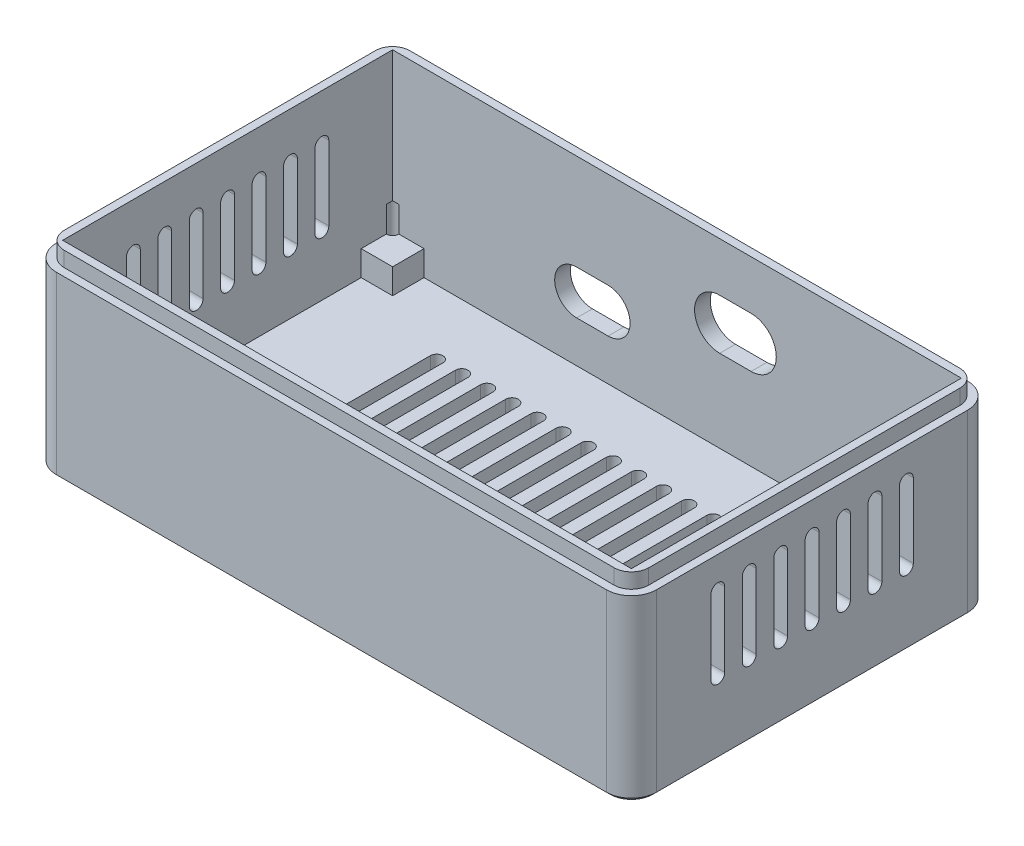
from build123d import *

# Parameters (mm, degrees)
CUERPO_DEPTH                  = 28.5
CROQUIS_HUECO_PCB_W           = 90.5
CROQUIS_HUECO_PCB_H           = 52.5
HUECO_PCB_DEPTH               = 26.5
CROQUIS_LABIO_W               = 90.5
CROQUIS_LABIO_H               = 52.5
LABIO_LIP_DEPTH               = 2.4
CROQUIS_APOYOS_W              = 5
CROQUIS_APOYOS_H              = 5
APOYOS_PCB_DEPTH              = 4
CROQUIS_ALIVIOS_R             = 1
ALIVIOS_ESQUINAS_DEPTH        = 8.1
SALIDAS_USB_Y_PANEL_DEPTH     = 64.729388825
VENTILAS_LATERALES_DEPTH      = 64.729388825
VENTILAS_LATERALES_DEPTH_BACK = 64.729388825
REJILLA_PISO_DEPTH            = 2
CHAFLAN_BASE_SIZE             = 0.6


with BuildPart() as part:
    # Croquis_contorno → Cuerpo (new body)
    with BuildSketch(Plane(origin=(0, 0, 0), x_dir=(1, 0, 0), z_dir=(0, 1, 0))):
        with BuildLine():
            Line((-43.75, -28.75), (43.75, -28.75))
            ThreePointArc((43.75, -28.75), (46.578427125, -27.578427125), (47.75, -24.75))
            Line((47.75, -24.75), (47.75, 24.75))
            ThreePointArc((47.75, 24.75), (46.578427125, 27.578427125), (43.75, 28.75))
            Line((43.75, 28.75), (-43.75, 28.75))
            ThreePointArc((-43.75, 28.75), (-46.578427125, 27.578427125), (-47.75, 24.75))
            Line((-47.75, 24.75), (-47.75, -24.75))
            ThreePointArc((-47.75, -24.75), (-46.578427125, -27.578427125), (-43.75, -28.75))
        make_face()
    extrude(amount=CUERPO_DEPTH)

    # Croquis_hueco_PCB → Hueco_PCB (cut)
    with BuildSketch(Plane(origin=(0, 28.5, 0), x_dir=(1, 0, 0), z_dir=(0, 1, 0))):
        Rectangle(CROQUIS_HUECO_PCB_W, CROQUIS_HUECO_PCB_H)
    extrude(amount=-HUECO_PCB_DEPTH, mode=Mode.SUBTRACT)

    # Croquis_labio → Labio_lip (add)
    with BuildSketch(Plane(origin=(0, 28.5, 0), x_dir=(1, 0, 0), z_dir=(0, 1, 0))):
        with BuildLine():
            Line((-43.75, -27.5), (43.75, -27.5))
            ThreePointArc((43.75, -27.5), (45.694543648, -26.694543648), (46.5, -24.75))
            Line((46.5, -24.75), (46.5, 24.75))
            ThreePointArc((46.5, 24.75), (45.694543648, 26.694543648), (43.75, 27.5))
            Line((43.75, 27.5), (-43.75, 27.5))
            ThreePointArc((-43.75, 27.5), (-45.694543648, 26.694543648), (-46.5, 24.75))
            Line((-46.5, 24.75), (-46.5, -24.75))
            ThreePointArc((-46.5, -24.75), (-45.694543648, -26.694543648), (-43.75, -27.5))
        make_face()
        Rectangle(CROQUIS_LABIO_W, CROQUIS_LABIO_H, mode=Mode.SUBTRACT)
    extrude(amount=LABIO_LIP_DEPTH)

    # Croquis_apoyos → Apoyos_PCB (add)
    with BuildSketch(Plane(origin=(0, 2, 0), x_dir=(1, 0, 0), z_dir=(0, 1, 0))):
        with Locations((-42.75, -23.75)):
            Rectangle(CROQUIS_APOYOS_W, CROQUIS_APOYOS_H)
        with Locations((-42.75, 23.75)):
            Rectangle(CROQUIS_APOYOS_W, CROQUIS_APOYOS_H)
        with Locations((42.75, -23.75)):
            Rectangle(CROQUIS_APOYOS_W, CROQUIS_APOYOS_H)
        with Locations((42.75, 23.75)):
            Rectangle(CROQUIS_APOYOS_W, CROQUIS_APOYOS_H)
    extrude(amount=APOYOS_PCB_DEPTH)

    # Croquis_alivios → Alivios_esquinas (cut)
    with BuildSketch(Plane(origin=(0, 2, 0), x_dir=(1, 0, 0), z_dir=(0, 1, 0))):
        with Locations((-45.25, -26.25)):
            Circle(CROQUIS_ALIVIOS_R)
        with Locations((-45.25, 26.25)):
            Circle(CROQUIS_ALIVIOS_R)
        with Locations((45.25, -26.25)):
            Circle(CROQUIS_ALIVIOS_R)
        with Locations((45.25, 26.25)):
            Circle(CROQUIS_ALIVIOS_R)
    extrude(amount=ALIVIOS_ESQUINAS_DEPTH, mode=Mode.SUBTRACT)

    # Croquis_salidas → Salidas_USB_y_panel (cut, through all)
    with BuildSketch(Plane.XY):
        with BuildLine():
            Line((6.8, 23.1), (11.8, 23.1))
            ThreePointArc((11.8, 23.1), (15.8, 19.1), (11.8, 15.1))
            Line((11.8, 15.1), (6.8, 15.1))
            ThreePointArc((6.8, 15.1), (2.8, 19.1), (6.8, 23.1))
        make_face()
        with BuildLine():
            Line((-15.96, 15.6), (-10.96, 15.6))
            ThreePointArc((-10.96, 15.6), (-7.46, 12.1), (-10.96, 8.6))
            Line((-10.96, 8.6), (-15.96, 8.6))
            ThreePointArc((-15.96, 8.6), (-19.46, 12.1), (-15.96, 15.6))
        make_face()
    extrude(amount=-SALIDAS_USB_Y_PANEL_DEPTH, mode=Mode.SUBTRACT)

    # Croquis_ventilas → Ventilas_laterales (cut, two sides: drawn at the far end of the back side and taken through both)
    with BuildSketch(Plane(origin=(0, 0, 0), x_dir=(0, 0, -1), z_dir=(1, 0, 0)).offset(-VENTILAS_LATERALES_DEPTH_BACK)):
        with BuildLine():
            Line((-16.1, 11.7), (-16.1, 23.5))
            ThreePointArc((-16.1, 23.5), (-15, 24.6), (-13.9, 23.5))
            Line((-13.9, 23.5), (-13.9, 11.7))
            ThreePointArc((-13.9, 11.7), (-15, 10.6), (-16.1, 11.7))
        make_face()
        with BuildLine():
            Line((-11.1, 11.7), (-11.1, 23.5))
            ThreePointArc((-11.1, 23.5), (-10, 24.6), (-8.9, 23.5))
            Line((-8.9, 23.5), (-8.9, 11.7))
            ThreePointArc((-8.9, 11.7), (-10, 10.6), (-11.1, 11.7))
        make_face()
        with BuildLine():
            Line((-6.1, 11.7), (-6.1, 23.5))
            ThreePointArc((-6.1, 23.5), (-5, 24.6), (-3.9, 23.5))
            Line((-3.9, 23.5), (-3.9, 11.7))
            ThreePointArc((-3.9, 11.7), (-5, 10.6), (-6.1, 11.7))
        make_face()
        with BuildLine():
            Line((-1.1, 11.7), (-1.1, 23.5))
            ThreePointArc((-1.1, 23.5), (0, 24.6), (1.1, 23.5))
            Line((1.1, 23.5), (1.1, 11.7))
            ThreePointArc((1.1, 11.7), (0, 10.6), (-1.1, 11.7))
        make_face()
        with BuildLine():
            Line((3.9, 11.7), (3.9, 23.5))
            ThreePointArc((3.9, 23.5), (5, 24.6), (6.1, 23.5))
            Line((6.1, 23.5), (6.1, 11.7))
            ThreePointArc((6.1, 11.7), (5, 10.6), (3.9, 11.7))
        make_face()
        with BuildLine():
            Line((8.9, 11.7), (8.9, 23.5))
            ThreePointArc((8.9, 23.5), (10, 24.6), (11.1, 23.5))
            Line((11.1, 23.5), (11.1, 11.7))
            ThreePointArc((11.1, 11.7), (10, 10.6), (8.9, 11.7))
        make_face()
        with BuildLine():
            Line((13.9, 11.7), (13.9, 23.5))
            ThreePointArc((13.9, 23.5), (15, 24.6), (16.1, 23.5))
            Line((16.1, 23.5), (16.1, 11.7))
            ThreePointArc((16.1, 11.7), (15, 10.6), (13.9, 11.7))
        make_face()
    extrude(amount=VENTILAS_LATERALES_DEPTH + VENTILAS_LATERALES_DEPTH_BACK, mode=Mode.SUBTRACT)

    # Croquis_rejilla_piso → Rejilla_piso (cut)
    with BuildSketch(Plane(origin=(0, 0, 0), x_dir=(1, 0, 0), z_dir=(0, 1, 0))):
        with BuildLine():
            Line((-29, -16), (-29, 16))
            ThreePointArc((-29, 16), (-28, 17), (-27, 16))
            Line((-27, 16), (-27, -16))
            ThreePointArc((-27, -16), (-28, -17), (-29, -16))
        make_face()
        with BuildLine():
            Line((-25, -16), (-25, 16))
            ThreePointArc((-25, 16), (-24, 17), (-23, 16))
            Line((-23, 16), (-23, -16))
            ThreePointArc((-23, -16), (-24, -17), (-25, -16))
        make_face()
        with BuildLine():
            Line((-21, -16), (-21, 16))
            ThreePointArc((-21, 16), (-20, 17), (-19, 16))
            Line((-19, 16), (-19, -16))
            ThreePointArc((-19, -16), (-20, -17), (-21, -16))
        make_face()
        with BuildLine():
            Line((-17, -16), (-17, 16))
            ThreePointArc((-17, 16), (-16, 17), (-15, 16))
            Line((-15, 16), (-15, -16))
            ThreePointArc((-15, -16), (-16, -17), (-17, -16))
        make_face()
        with BuildLine():
            Line((-13, -16), (-13, 16))
            ThreePointArc((-13, 16), (-12, 17), (-11, 16))
            Line((-11, 16), (-11, -16))
            ThreePointArc((-11, -16), (-12, -17), (-13, -16))
        make_face()
        with BuildLine():
            Line((-9, -16), (-9, 16))
            ThreePointArc((-9, 16), (-8, 17), (-7, 16))
            Line((-7, 16), (-7, -16))
            ThreePointArc((-7, -16), (-8, -17), (-9, -16))
        make_face()
        with BuildLine():
            Line((-5, -16), (-5, 16))
            ThreePointArc((-5, 16), (-4, 17), (-3, 16))
            Line((-3, 16), (-3, -16))
            ThreePointArc((-3, -16), (-4, -17), (-5, -16))
        make_face()
        with BuildLine():
            Line((-1, -16), (-1, 16))
            ThreePointArc((-1, 16), (0, 17), (1, 16))
            Line((1, 16), (1, -16))
            ThreePointArc((1, -16), (0, -17), (-1, -16))
        make_face()
        with BuildLine():
            Line((3, -16), (3, 16))
            ThreePointArc((3, 16), (4, 17), (5, 16))
            Line((5, 16), (5, -16))
            ThreePointArc((5, -16), (4, -17), (3, -16))
        make_face()
        with BuildLine():
            Line((7, -16), (7, 16))
            ThreePointArc((7, 16), (8, 17), (9, 16))
            Line((9, 16), (9, -16))
            ThreePointArc((9, -16), (8, -17), (7, -16))
        make_face()
        with BuildLine():
            Line((11, -16), (11, 16))
            ThreePointArc((11, 16), (12, 17), (13, 16))
            Line((13, 16), (13, -16))
            ThreePointArc((13, -16), (12, -17), (11, -16))
        make_face()
        with BuildLine():
            Line((15, -16), (15, 16))
            ThreePointArc((15, 16), (16, 17), (17, 16))
            Line((17, 16), (17, -16))
            ThreePointArc((17, -16), (16, -17), (15, -16))
        make_face()
        with BuildLine():
            Line((19, -16), (19, 16))
            ThreePointArc((19, 16), (20, 17), (21, 16))
            Line((21, 16), (21, -16))
            ThreePointArc((21, -16), (20, -17), (19, -16))
        make_face()
        with BuildLine():
            Line((23, -16), (23, 16))
            ThreePointArc((23, 16), (24, 17), (25, 16))
            Line((25, 16), (25, -16))
            ThreePointArc((25, -16), (24, -17), (23, -16))
        make_face()
        with BuildLine():
            Line((27, -16), (27, 16))
            ThreePointArc((27, 16), (28, 17), (29, 16))
            Line((29, 16), (29, -16))
            ThreePointArc((29, -16), (28, -17), (27, -16))
        make_face()
    extrude(amount=REJILLA_PISO_DEPTH, mode=Mode.SUBTRACT)

    # Chaflan_base
    chaflan_base_edges = [part.edges().sort_by_distance(p)[0] for p in [
        (0, 0, 28.75),
        (46.578427125, 0, 27.578427125),
        (47.75, 0, 0),
        (46.578427125, 0, -27.578427125),
        (0, 0, -28.75),
        (-46.578427125, 0, -27.578427125),
        (-47.75, 0, 0),
        (-46.578427125, 0, 27.578427125),
    ]]
    chamfer(chaflan_base_edges, length=CHAFLAN_BASE_SIZE)


solid = part.part
